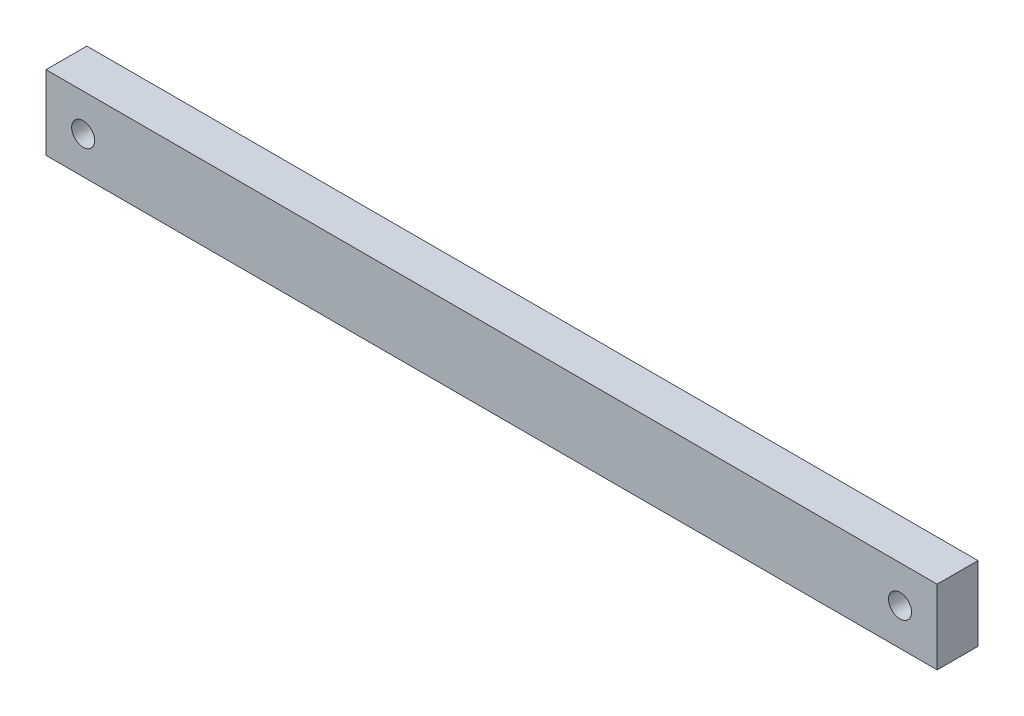
from build123d import *

# Parameters (mm, degrees)
SKETCH_1_W          = 120
SKETCH_1_H          = 10
EXTRUDE_1_DEPTH     = 5.5
SKETCH_2_R          = 1.55
CUT_EXTRUDE_1_DEPTH = 61.458663564


with BuildPart() as part:
    # ｽｹｯﾁ1 → ﾎﾞｽ - 押し出し1 (new body)
    with BuildSketch(Plane.XY):
        Rectangle(SKETCH_1_W, SKETCH_1_H)
    extrude(amount=EXTRUDE_1_DEPTH)

    # ｽｹｯﾁ2 → ｶｯﾄ - 押し出し1 (cut, through all)
    with BuildSketch(Plane.XY.offset(5.5)):
        with Locations((-55, 0)):
            Circle(SKETCH_2_R)
        with Locations((55, 0)):
            Circle(SKETCH_2_R)
    extrude(amount=-CUT_EXTRUDE_1_DEPTH, mode=Mode.SUBTRACT)


solid = part.part
